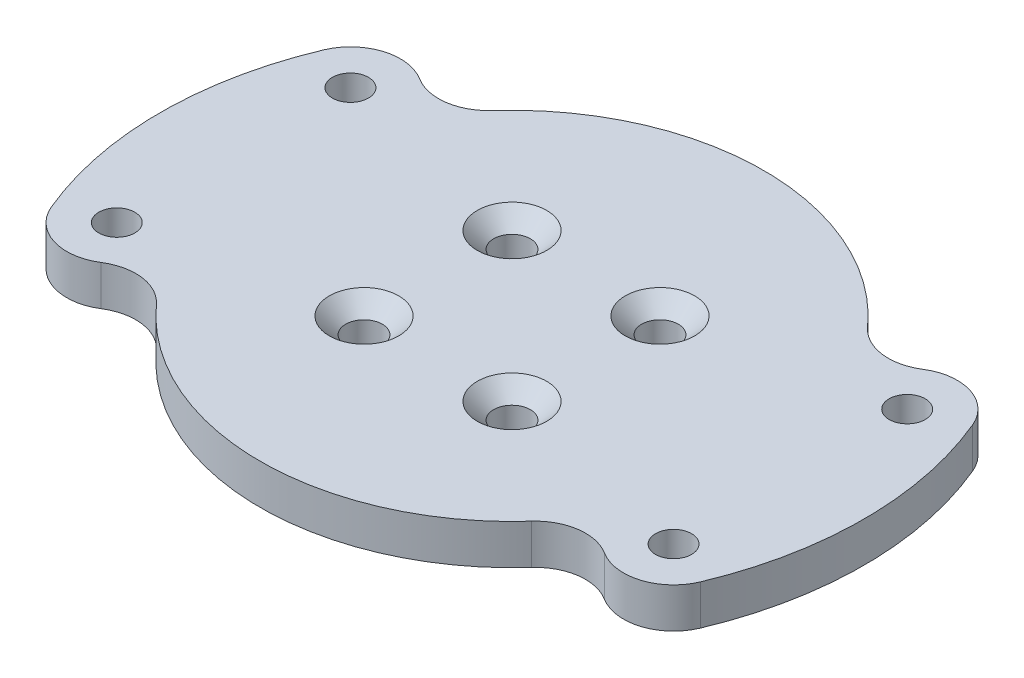
from build123d import *

# Parameters (mm, degrees)
SKETCH1_R                                       = 2.6
SKETCH1_R_2                                     = 2.7
BOSS_EXTRUDE1_DEPTH                             = 6
FILLET1_R                                       = 7.5
CSK_FOR_M5_FLAT_HEAD_MACHINE_SCREW1_D           = 5.5
CSK_FOR_M5_FLAT_HEAD_MACHINE_SCREW1_CSINK_D     = 10.4
CSK_FOR_M5_FLAT_HEAD_MACHINE_SCREW1_CSINK_ANGLE = 90


with BuildPart() as part:
    # Sketch1 → Boss-Extrude1 (new body)
    with BuildSketch(Plane(origin=(0, 0, 0), x_dir=(1, 0, 0), z_dir=(0, 1, 0))):
        with BuildLine():
            Line((31.883633055, 20.164562188), (44.561021943, 28.182280752))
            ThreePointArc((44.561021943, 28.182280752), (52.725, 0), (44.561021943, -28.182280752))
            Line((44.561021943, -28.182280752), (31.883633055, -20.164562188))
            ThreePointArc((31.883633055, -20.164562188), (0, -37.725), (-31.883633055, -20.164562188))
            Line((-31.883633055, -20.164562188), (-44.561021943, -28.182280752))
            ThreePointArc((-44.561021943, -28.182280752), (-52.725, 0), (-44.561021943, 28.182280752))
            Line((-44.561021943, 28.182280752), (-31.883633055, 20.164562188))
            ThreePointArc((-31.883633055, 20.164562188), (0, 37.725), (31.883633055, 20.164562188))
        make_face()
        with Locations(Location((-11.083898795, 11.083898795, 0), (0, 0, 270))):
            Circle(SKETCH1_R, mode=Mode.SUBTRACT)
        with Locations(Location((11.083898795, 11.083898795, 0), (0, 0, 270))):
            Circle(SKETCH1_R, mode=Mode.SUBTRACT)
        with Locations(Location((11.083898795, -11.083898795, 0), (0, 0, 270))):
            Circle(SKETCH1_R, mode=Mode.SUBTRACT)
        with Locations(Location((-11.083898795, -11.083898795, 0), (0, 0, 270))):
            Circle(SKETCH1_R, mode=Mode.SUBTRACT)
        with Locations(Location((41.701925915, 17.5, 0), (0, 0, 270))):
            Circle(SKETCH1_R_2, mode=Mode.SUBTRACT)
        with Locations(Location((41.701925915, -17.5, 0), (0, 0, 270))):
            Circle(SKETCH1_R_2, mode=Mode.SUBTRACT)
        with Locations(Location((-41.701925915, 17.5, 0), (0, 0, 90))):
            Circle(SKETCH1_R_2, mode=Mode.SUBTRACT)
        with Locations(Location((-41.701925915, -17.5, 0), (0, 0, 90))):
            Circle(SKETCH1_R_2, mode=Mode.SUBTRACT)
    extrude(amount=BOSS_EXTRUDE1_DEPTH)

    # Fillet1
    fillet1_edges = [part.edges().sort_by_distance(p)[0] for p in [
        (44.561021943, 3, 28.182280752),
        (31.883633055, 3, 20.164562188),
        (-44.561021943, 3, 28.182280752),
        (-31.883633055, 3, 20.164562188),
        (44.561021943, 3, -28.182280752),
        (31.883633055, 3, -20.164562188),
        (-44.561021943, 3, -28.182280752),
        (-31.883633055, 3, -20.164562188),
    ]]
    fillet(fillet1_edges, radius=FILLET1_R - 0.0001)  # a hair under: the kernel refuses the full size

    # CSK for M5 Flat Head Machine Screw1 (through all)
    with Locations(Plane(origin=(0, 6, 0), x_dir=(1, 0, 0), z_dir=(0, 1, 0))):
        with Locations((-11.083898795, 11.083898795), (11.083898795, 11.083898795), (11.083898795, -11.083898795), (-11.083898795, -11.083898795)):
            CounterSinkHole(CSK_FOR_M5_FLAT_HEAD_MACHINE_SCREW1_D / 2, CSK_FOR_M5_FLAT_HEAD_MACHINE_SCREW1_CSINK_D / 2, counter_sink_angle=CSK_FOR_M5_FLAT_HEAD_MACHINE_SCREW1_CSINK_ANGLE)


solid = part.part
